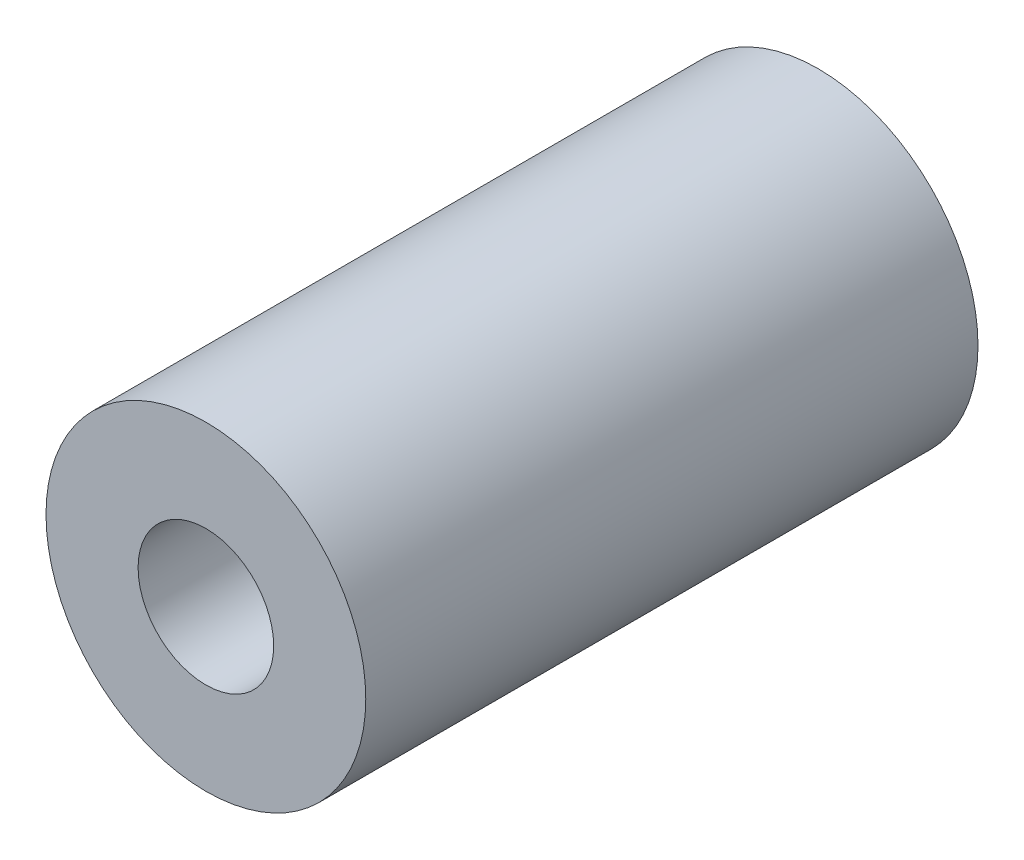
from build123d import *

# Parameters (mm, degrees)
SKETCH1_R                            = 4.7625
BOSS_EXTRUDE1_DEPTH                  = 9.1186
F_10_32_TAPPED_HOLE2_D               = 4.0386
F_10_32_TAPPED_HOLE2_DEPTH           = 15.07744
F_10_32_TAPPED_HOLE2_TIP             = 1.213317848
F_10_32_TAPPED_HOLE2_ON_FACE_2_D     = 4.0386
F_10_32_TAPPED_HOLE2_ON_FACE_2_DEPTH = 15.07744
F_10_32_TAPPED_HOLE2_ON_FACE_2_TIP   = 1.213317848


with BuildPart() as part:
    # Sketch1 → Boss-Extrude1 (new, symmetric)
    with BuildSketch(Plane.XY):
        Circle(SKETCH1_R)
    extrude(amount=BOSS_EXTRUDE1_DEPTH, both=True)

    # #10-32 Tapped Hole2
    with Locations(Plane.XY.offset(9.1186)):
        with Locations((0, 0)):
            Hole(F_10_32_TAPPED_HOLE2_D / 2, depth=F_10_32_TAPPED_HOLE2_DEPTH)
            with Locations((0, 0, -(F_10_32_TAPPED_HOLE2_DEPTH + F_10_32_TAPPED_HOLE2_TIP / 2))):  # 118° drill point
                Cone(0, F_10_32_TAPPED_HOLE2_D / 2, F_10_32_TAPPED_HOLE2_TIP, mode=Mode.SUBTRACT)

    # #10-32 Tapped Hole2 on face 2
    with Locations(Plane(origin=(0, 0, -9.1186), x_dir=(-1, 0, 0), z_dir=(0, 0, -1))):
        with Locations((0, 0)):
            Hole(F_10_32_TAPPED_HOLE2_ON_FACE_2_D / 2, depth=F_10_32_TAPPED_HOLE2_ON_FACE_2_DEPTH)
            with Locations((0, 0, -(F_10_32_TAPPED_HOLE2_ON_FACE_2_DEPTH + F_10_32_TAPPED_HOLE2_ON_FACE_2_TIP / 2))):  # 118° drill point
                Cone(0, F_10_32_TAPPED_HOLE2_ON_FACE_2_D / 2, F_10_32_TAPPED_HOLE2_ON_FACE_2_TIP, mode=Mode.SUBTRACT)


solid = part.part
